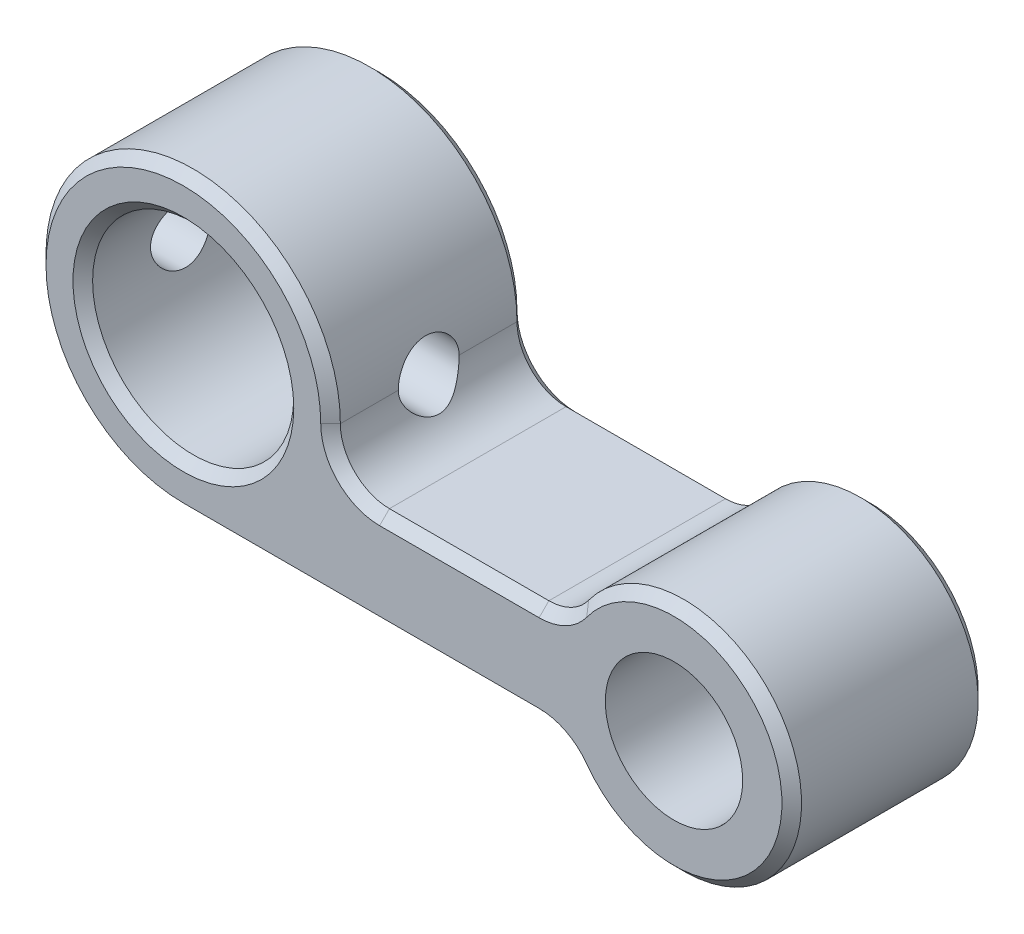
from build123d import *

# Parameters (mm, degrees)
SKETCH_1_R               = 15
SKETCH_1_R_2             = 10.25
EXTRUDE_1_DEPTH          = 10
CUT_EXTRUDE_1_DEPTH      = 24.452078799
CUT_EXTRUDE_1_DEPTH_BACK = 24.452078799
SKETCH_2_R               = 3.1
SKETCH_3_R               = 12
SKETCH_3_R_2             = 7
EXTRUDE_2_DEPTH          = 10
EXTRUDE_3_DEPTH          = 10
FILLET_1_R               = 5
CHAMFER_1_SIZE           = 1


with BuildPart() as part:
    # 草图1 → 凸台-拉伸1 (new, symmetric)
    with BuildSketch(Plane.XY):
        Circle(SKETCH_1_R)
        Circle(SKETCH_1_R_2, mode=Mode.SUBTRACT)
    extrude(amount=EXTRUDE_1_DEPTH, both=True)

    # 草图2 → 切除-拉伸1 (cut, two sides: drawn at the far end of the back side and taken through both)
    with BuildSketch(Plane(origin=(0, 0, 0), x_dir=(0, 0, -1), z_dir=(1, 0, 0)).offset(-CUT_EXTRUDE_1_DEPTH_BACK)):
        Circle(SKETCH_2_R)
    extrude(amount=CUT_EXTRUDE_1_DEPTH + CUT_EXTRUDE_1_DEPTH_BACK, mode=Mode.SUBTRACT)



with BuildPart() as body_2:
    # 草图3 → 凸台-拉伸2 (new, symmetric)
    with BuildSketch(Plane.XY):
        with Locations((50, -10)):
            Circle(SKETCH_3_R)
        with Locations((50, -10)):
            Circle(SKETCH_3_R_2, mode=Mode.SUBTRACT)
    extrude(amount=EXTRUDE_2_DEPTH, both=True)


with BuildPart() as part_1:
    add(part.part)

    add(body_2.part)  # 凸台-拉伸3 merges body 2
    # 草图4 → 凸台-拉伸3 (add, symmetric)
    with BuildSketch(Plane.XY):
        with BuildLine():
            Line((40.202041029, -15), (0, -15))
            ThreePointArc((0, -15), (8.660254038, -12.247448714), (14.142135624, -5))
            Line((14.142135624, -5), (40.202041029, -5))
            ThreePointArc((40.202041029, -5), (39, -10), (40.202041029, -15))
        make_face()
    extrude(amount=EXTRUDE_3_DEPTH, both=True)

    # 圆角1
    # the kernel refuses this fillet: 5 mm, written as the material it adds along each edge
    with BuildSketch(Plane(origin=(14.142135624, -5, -10), x_dir=(0.1691019787257651, 0.9855985596534883, 0), z_dir=(0, 0, 1))) as fillet_1_piece_1_section:
        with BuildLine():
            CenterArc((5.918569255, -4.927992798), FILLET_1_R, 99.735610317, 90)
            Line((0.990576457, -5.773502692), (0, 0))
            ThreePointArc((0, 0), (2.536529681, -0.216021605), (5.073059362, 0))
        make_face()
    fillet_1_piece_1 = extrude(amount=20, mode=Mode.PRIVATE)
    fillet_1_piece_1 = fillet_1_piece_1 - Plane(origin=(15.878746953, 0, 0), x_dir=(0, 0, -1), z_dir=(-1, 0, 0)) * Cylinder(3.1, 64, mode=Mode.PRIVATE)
    add(fillet_1_piece_1)
    with BuildSketch(Plane(origin=(39.091287885, -15, -10), x_dir=(0.5049509852949774, -0.8631480188528684, 0), z_dir=(0, 0, 1))) as fillet_1_piece_2:
        with BuildLine():
            CenterArc((2.882176688, -4.975245074), FILLET_1_R, 95.70378036, 53.968120928)
            Line((-1.433563406, -2.450490147), (0, 0))
            ThreePointArc((0, 0), (1.192624836, -0.059411824), (2.385249673, 0))
        make_face()
    extrude(amount=20)
    with BuildSketch(Plane(origin=(39.091287885, -5, -10), x_dir=(-1, 0, 0), z_dir=(0, 0, 1))) as fillet_1_piece_3:
        with BuildLine():
            CenterArc((2.83901497, -5), FILLET_1_R, 90, 53.968120928)
            ThreePointArc((-1.204434172, -2.058823529), (-0.550935888, -1.059411824), (0, 0))
            Line((0, 0), (2.83901497, 0))
        make_face()
    extrude(amount=20)

    # 倒角1
    chamfer_1_edges = [part_1.edges().sort_by_distance(p)[0] for p in [
        (18.126136458, -15, -10),
        (18.126136458, -15, 10),
        (62, -10, -10),
        (-10.25, 0, -10),
        (62, -10, 10),
        (28.126136458, -5, -10),
        (-10.25, 0, 10),
        (28.126136458, -5, 10),
        (-10.606601718, 10.606601718, -10),
        (-10.606601718, 10.606601718, 10),
        (38.520985948, -15.544336057, -10),
        (38.520985948, -15.544336057, 10),
        (38.520985948, -4.455663943, 10),
        (38.520985948, -4.455663943, -10),
        (16.464466094, -3.535533906, -10),
        (16.464466094, -3.535533906, 10),
    ]]
    chamfer(chamfer_1_edges, length=CHAMFER_1_SIZE)


solid = part_1.part
